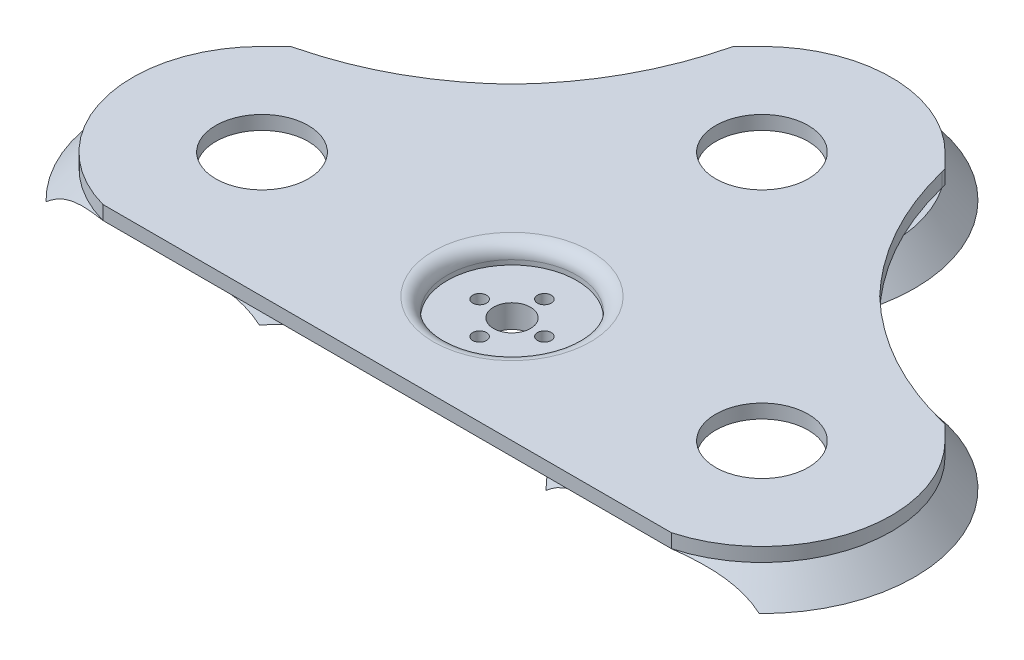
from build123d import *

# Parameters (mm, degrees)
SKETCH_1_R               = 19
SKETCH_1_R_2             = 10
EXTRUDE_1_DEPTH          = 3
SKETCH_4_R               = 14
SKETCH_4_R_2             = 1.5
SKETCH_4_R_3             = 4
EXTRUDE_2_DEPTH          = 5
SKETCH_5_R               = 19
SKETCH_5_R_2             = 14
EXTRUDE_3_DEPTH          = 9
EXTRUDE_START            = -3
SKETCH_6_R               = 14
EXTRUDE_4_DEPTH          = 3
PATTERN_CIRCULAR_1_COUNT = 2
PATTERN_CIRCULAR_1_ANGLE = 90
PATTERN_CIRCULAR_2_COUNT = 2
PATTERN_CIRCULAR_2_ANGLE = 90
CHAMFER_1_SIZE           = 3
SKETCH_9_R               = 10
CUT_EXTRUDE_1_DEPTH      = 10
CUT_EXTRUDE_3_DEPTH      = 10
CUT_EXTRUDE_3_DEPTH_BACK = 10
SKETCH_13_W              = 150
SKETCH_13_H              = 10
CUT_EXTRUDE_5_DEPTH      = 37
FILLET_2_R               = 1
FILLET_3_R               = 3
CUT_EXTRUDE_6_DEPTH      = 3


with BuildPart() as part:
    # 草图1 → 凸台-拉伸1 (new body)
    with BuildSketch(Plane(origin=(0, 0, 0), x_dir=(1, 0, 0), z_dir=(0, 1, 0))):
        Circle(SKETCH_1_R)
        Circle(SKETCH_1_R_2, mode=Mode.SUBTRACT)
    extrude(amount=EXTRUDE_1_DEPTH)

    # 草图4 → 凸台-拉伸2 (add)
    with BuildSketch(Plane(origin=(0, 3, 0), x_dir=(1, 0, 0), z_dir=(0, 1, 0))):
        Circle(SKETCH_4_R)
        with Locations((0, 7)):
            Circle(SKETCH_4_R_2, mode=Mode.SUBTRACT)
        with Locations((7, 0)):
            Circle(SKETCH_4_R_2, mode=Mode.SUBTRACT)
        with Locations((0, -7)):
            Circle(SKETCH_4_R_2, mode=Mode.SUBTRACT)
        with Locations((-7, 0)):
            Circle(SKETCH_4_R_2, mode=Mode.SUBTRACT)
        Circle(SKETCH_4_R_3, mode=Mode.SUBTRACT)
    extrude(amount=EXTRUDE_2_DEPTH)

    # 草图5 → 凸台-拉伸3 (add)
    with BuildSketch(Plane(origin=(0, 3, 0), x_dir=(1, 0, 0), z_dir=(0, 1, 0))):
        Circle(SKETCH_5_R)
        Circle(SKETCH_5_R_2, mode=Mode.SUBTRACT)
    extrude(amount=EXTRUDE_3_DEPTH)

    # 草图6 → 凸台-拉伸4 (add)
    with BuildSketch(Plane(origin=(0, 12, 0), x_dir=(1, 0, 0), z_dir=(0, 1, 0)).offset(EXTRUDE_START)):
        with BuildLine():
            Line((-19.798989873, 73.858989873), (-73.858989873, 19.798989873))
            ThreePointArc((-73.858989873, 19.798989873), (-79.92862691, -10.715136106), (-54.06, -28))
            Line((-54.06, -28), (54.06, -28))
            ThreePointArc((54.06, -28), (79.92862691, -10.715136106), (73.858989873, 19.798989873))
            Line((73.858989873, 19.798989873), (19.798989873, 73.858989873))
            ThreePointArc((19.798989873, 73.858989873), (0, 82.06), (-19.798989873, 73.858989873))
        make_face()
        Circle(SKETCH_6_R, mode=Mode.SUBTRACT)
    extrude(amount=EXTRUDE_4_DEPTH)

    # 草图8 → 旋转1 (revolve)
    with BuildSketch(Plane(origin=(0, 0, 0), x_dir=(0, 0, -1), z_dir=(1, 0, 0))):
        Polygon((82.06, 9), (80.06, 9), (85.094597787, 3), (87.094597787, 3), align=None)
    revolve_1 = revolve(axis=Axis((0, 9, -54.06), (0, -1, 0)))

    # 阵列(圆周)1: 旋转1 ×2 about axis
    pattern_circular_1_axis = Axis((0, -0.6, 0), (0, 1, 0))
    for i in range(1, PATTERN_CIRCULAR_1_COUNT):
        add(revolve_1.rotate(pattern_circular_1_axis, i * PATTERN_CIRCULAR_1_ANGLE / (PATTERN_CIRCULAR_1_COUNT - 1)))

    # 阵列(圆周)2: 旋转1 ×2 about axis
    pattern_circular_2_axis = Axis((0, -0.6, 0), (0, -1, 0))
    for i in range(1, PATTERN_CIRCULAR_2_COUNT):
        add(revolve_1.rotate(pattern_circular_2_axis, i * PATTERN_CIRCULAR_2_ANGLE / (PATTERN_CIRCULAR_2_COUNT - 1)))

    # 倒角1
    chamfer_1_edges = [part.edges().sort_by_distance(p)[0] for p in [
        (-19, 0, 0),
    ]]
    chamfer(chamfer_1_edges, length=CHAMFER_1_SIZE)

    # 草图9 → 切除-拉伸1 (cut)
    with BuildSketch(Plane.XZ.offset(-9)):
        with Locations((0, -54.06)):
            Circle(SKETCH_9_R)
        with Locations((-54.06, 0)):
            Circle(SKETCH_9_R)
        with Locations((54.06, 0)):
            Circle(SKETCH_9_R)
    extrude(amount=-CUT_EXTRUDE_1_DEPTH, mode=Mode.SUBTRACT)

    # 草图13 → 切除-拉伸3 (cut, two sides: drawn at the far end of the back side and taken through both)
    with BuildSketch(Plane.XZ.offset(-9).offset(-CUT_EXTRUDE_3_DEPTH_BACK)):
        with Locations((0, 32)):
            Rectangle(SKETCH_13_W, SKETCH_13_H)
    extrude(amount=CUT_EXTRUDE_3_DEPTH + CUT_EXTRUDE_3_DEPTH_BACK, mode=Mode.SUBTRACT)

    # 草图14 → 切除-拉伸5 (cut)
    with BuildSketch(Plane.XY):
        with BuildLine():
            Line((46.643801513, 9), (61.476198487, 9))
            add(Edge.make_bspline(
                [(80.12, 0), (73.176867554, 8.16412003), (61.476198487, 9)],
                knots=[0, 0, 0, 1, 1, 1], degree=2))
            Line((80.12, 0), (28, 0))
            add(Edge.make_bspline(
                [(28, 0), (34.943132446, 8.16412003), (46.643801513, 9)],
                knots=[0, 0, 0, 1, 1, 1], degree=2))
        make_face()
        with BuildLine():
            Line((-46.643801513, 9), (-61.476198487, 9))
            add(Edge.make_bspline(
                [(-80.12, 0), (-73.176867554, 8.16412003), (-61.476198487, 9)],
                knots=[0, 0, 0, 1, 1, 1], degree=2))
            Line((-80.12, 0), (-28, 0))
            add(Edge.make_bspline(
                [(-28, 0), (-34.943132446, 8.16412003), (-46.643801513, 9)],
                knots=[0, 0, 0, 1, 1, 1], degree=2))
        make_face()
    extrude(amount=CUT_EXTRUDE_5_DEPTH, mode=Mode.SUBTRACT)

    # 圆角2
    fillet_2_edges = [part.edges().sort_by_distance(p)[0] for p in [
        (54.06, 3, -31.034597787),
        (0, 3, -23.025402213),
        (-54.06, 3, -31.034597787),
    ]]
    fillet(fillet_2_edges, radius=FILLET_2_R)

    # 圆角3
    fillet_3_edges = [part.edges().sort_by_distance(p)[0] for p in [
        (-19, 9, 0),
        (-14, 12, 0),
    ]]
    fillet(fillet_3_edges, radius=FILLET_3_R)

    # 草图15 → 切除-拉伸6 (cut)
    with BuildSketch(Plane(origin=(0, 12, 0), x_dir=(1, 0, 0), z_dir=(0, 1, 0))):
        with BuildLine():
            Line((-69.815576591, 23.146529033), (-70.76615832, 22.891821426))
            Line((-70.76615832, 22.891821426), (-22.891821426, 70.76615832))
            Line((-22.891821426, 70.76615832), (-23.146529033, 69.815576591))
            add(Edge.make_bspline(
                [(-23.146529033, 69.815576591), (-27.520231774, 52.527398209), (-39.757922061, 39.757922061)],
                knots=[0, 0, 0, 1, 1, 1], degree=2))
            add(Edge.make_bspline(
                [(-69.815576591, 23.146529033), (-52.527398209, 27.520231774), (-39.757922061, 39.757922061)],
                knots=[0, 0, 0, 1, 1, 1], degree=2))
        make_face()
        with BuildLine():
            Line((70.76615832, 22.891821426), (22.891821426, 70.76615832))
            Line((22.891821426, 70.76615832), (23.146529033, 69.815576591))
            add(Edge.make_bspline(
                [(23.146529033, 69.815576591), (27.520231774, 52.527398209), (39.757922061, 39.757922061)],
                knots=[0, 0, 0, 1, 1, 1], degree=2))
            add(Edge.make_bspline(
                [(69.815576591, 23.146529033), (52.527398209, 27.520231774), (39.757922061, 39.757922061)],
                knots=[0, 0, 0, 1, 1, 1], degree=2))
            Line((69.815576591, 23.146529033), (70.76615832, 22.891821426))
        make_face()
    extrude(amount=-CUT_EXTRUDE_6_DEPTH, mode=Mode.SUBTRACT)


solid = part.part
